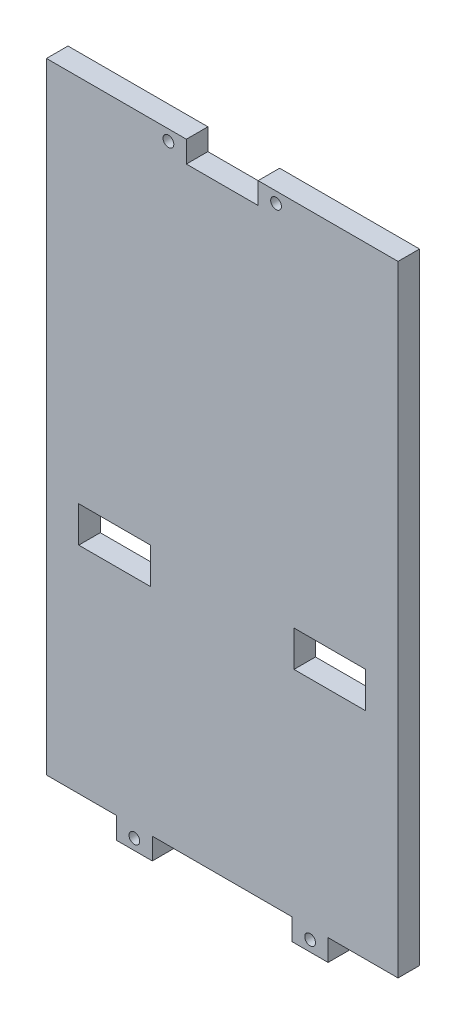
from build123d import *

# Parameters (mm, degrees)
ESQUISSE1_W             = 98
ESQUISSE1_H             = 173
ESQUISSE1_W_2           = 20
ESQUISSE1_H_2           = 10
BOSS_EXTRU_1_DEPTH      = 6
ESQUISSE2_W             = 10
ESQUISSE2_H             = 6
BOSS_EXTRU_2_DEPTH      = 6
ESQUISSE3_R             = 1.5
ENL_V_MAT_EXTRU_1_DEPTH = 6
ESQUISSE4_W             = 20
ESQUISSE4_H             = 6
ENL_V_MAT_EXTRU_2_DEPTH = 6


with BuildPart() as part:
    # Esquisse1 → Boss.-Extru.1 (new body)
    with BuildSketch(Plane.XY):
        Rectangle(ESQUISSE1_W, ESQUISSE1_H)
        with Locations((30, -21.5)):
            Rectangle(ESQUISSE1_W_2, ESQUISSE1_H_2, mode=Mode.SUBTRACT)
        with Locations((-30, -21.5)):
            Rectangle(ESQUISSE1_W_2, ESQUISSE1_H_2, mode=Mode.SUBTRACT)
    extrude(amount=BOSS_EXTRU_1_DEPTH)

    # Esquisse2 → Boss.-Extru.2 (add)
    with BuildSketch(Plane.XY.offset(6)):
        with Locations((24.5, -89.5)):
            Rectangle(ESQUISSE2_W, ESQUISSE2_H)
        with Locations((-24.5, -89.5)):
            Rectangle(ESQUISSE2_W, ESQUISSE2_H)
    extrude(amount=-BOSS_EXTRU_2_DEPTH)

    # Esquisse3 → Enlèv. mat.-Extru.1 (cut)
    with BuildSketch(Plane.XY.offset(6)):
        with Locations((-15, 83.5)):
            Circle(ESQUISSE3_R)
        with Locations((24.5, -89.5)):
            Circle(ESQUISSE3_R)
        with Locations((-24.5, -89.5)):
            Circle(ESQUISSE3_R)
        with Locations((15, 83.5)):
            Circle(ESQUISSE3_R)
    extrude(amount=-ENL_V_MAT_EXTRU_1_DEPTH, mode=Mode.SUBTRACT)

    # Esquisse4 → Enlèv. mat.-Extru.2 (cut)
    with BuildSketch(Plane.XY.offset(6)):
        with Locations((0, 83.5)):
            Rectangle(ESQUISSE4_W, ESQUISSE4_H)
    extrude(amount=-ENL_V_MAT_EXTRU_2_DEPTH, mode=Mode.SUBTRACT)


solid = part.part
